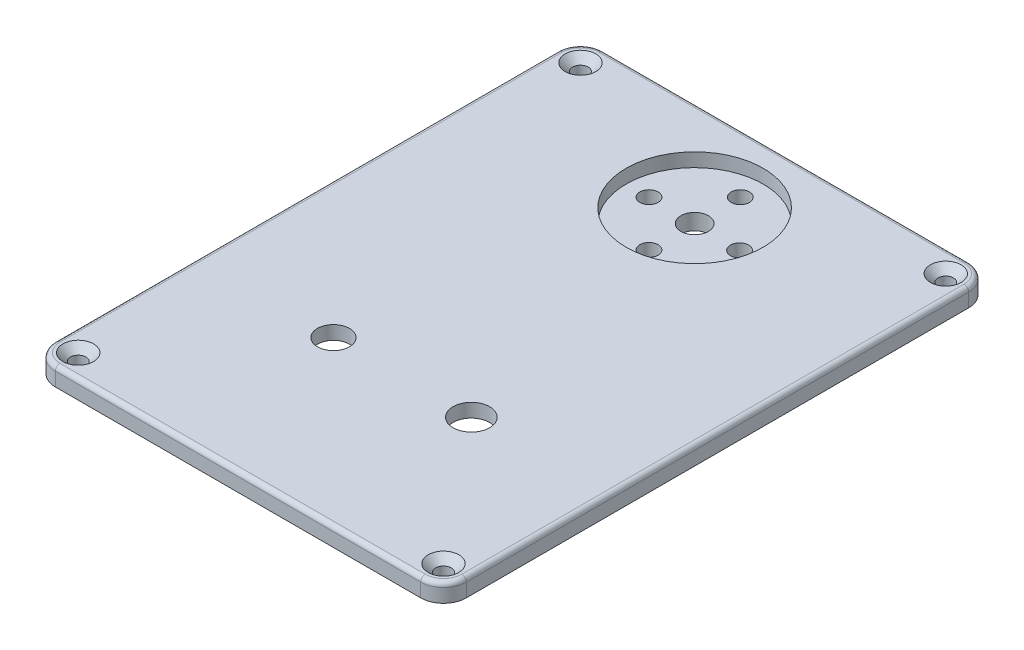
from build123d import *

# Parameters (mm, degrees)
SKETCH_2_W                   = 90
SKETCH_2_H                   = 120
SKETCH_2_R                   = 15
EXTRUDE_1_DEPTH              = 3
SKETCH_3_W                   = 90
SKETCH_3_H                   = 120
EXTRUDE_2_DEPTH              = 1
SKETCH_8_R                   = 3
EXTRUDE_5_DEPTH              = 3.5
SKETCH_10_R                  = 2
CUT_EXTRUDE_2_DEPTH          = 3.1
HOLE_WIZARD_M3_3_D           = 3.4
HOLE_WIZARD_M3_3_CSINK_D     = 6.72
HOLE_WIZARD_M3_3_CSINK_ANGLE = 90
FILLET_2_R                   = 5
FILLET_3_R                   = 5
FILLET_4_R                   = 5
FILLET_5_R                   = 5
FILLET_6_R                   = 5
FILLET_7_R                   = 5
FILLET_8_R                   = 5
FILLET_9_R                   = 5
FILLET_10_R                  = 1
SKETCH_16_R                  = 3.5
SKETCH_16_R_2                = 4
CUT_EXTRUDE_3_DEPTH          = 3


with BuildPart() as part:
    # 草图2 → 凸台-拉伸1 (new body)
    with BuildSketch(Plane(origin=(0, 0, 0), x_dir=(1, 0, 0), z_dir=(0, 1, 0))):
        Rectangle(SKETCH_2_W, SKETCH_2_H)
        with Locations(Location((0, 40, 0), (0, 0, 270))):
            Circle(SKETCH_2_R, mode=Mode.SUBTRACT)
    extrude(amount=EXTRUDE_1_DEPTH)



with BuildPart() as body_2:
    # 草图3 → 凸台-拉伸2 (new body)
    with BuildSketch(Plane.XZ):
        Rectangle(SKETCH_3_W, SKETCH_3_H)
        Polygon((-42, -50), (-42, 50), (-35, 50), (-35, 57), (35, 57), (35, 50), (42, 50), (42, -50), (35, -50), (35, -57), (-35, -57), (-35, -50), align=None, mode=Mode.SUBTRACT)
    extrude(amount=EXTRUDE_2_DEPTH)


with BuildPart() as part_1:
    add(part.part)

    add(body_2.part)  # 凸台-拉伸5 merges body 2
    # 草图8 → 凸台-拉伸5 (add)
    with BuildSketch(Plane.XZ):
        with BuildLine():
            Line((-5.916079783, -57), (5.916079783, -57))
            ThreePointArc((5.916079783, -57), (0, -22), (-5.916079783, -57))
        make_face()
        with Locations(Location((0, -40, 0), (0, 0, 270))):
            Circle(SKETCH_8_R, mode=Mode.SUBTRACT)
    extrude(amount=EXTRUDE_5_DEPTH)

    # 草图10 → 切除-拉伸2 (cut)
    with BuildSketch(Plane(origin=(0, 0, 0), x_dir=(1, 0, 0), z_dir=(0, 1, 0))):
        with Locations(Location((0, 30, 0), (0, 0, 270))):
            Circle(SKETCH_10_R)
        with Locations(Location((10, 39.837399549, 0), (0, 0, 270))):
            Circle(SKETCH_10_R)
        with Locations(Location((0, 50, 0), (0, 0, 270))):
            Circle(SKETCH_10_R)
        with Locations(Location((-10, 40, 0), (0, 0, 270))):
            Circle(SKETCH_10_R)
    extrude(amount=-CUT_EXTRUDE_2_DEPTH, mode=Mode.SUBTRACT)

    # M3 六角凹锥坑螺钉的锥形沉头孔3 (through all)
    with Locations(Plane(origin=(0, 3, 0), x_dir=(1, 0, 0), z_dir=(0, 1, 0))):
        with Locations((-40, -55), (-40, 55), (40, 55), (40, -55)):
            CounterSinkHole(HOLE_WIZARD_M3_3_D / 2, HOLE_WIZARD_M3_3_CSINK_D / 2, counter_sink_angle=HOLE_WIZARD_M3_3_CSINK_ANGLE)

    # 圆角2
    fillet_2_edges = [part_1.edges().sort_by_distance(p)[0] for p in [
        (35, -0.5, -50),
    ]]
    fillet(fillet_2_edges, radius=FILLET_2_R)

    # 圆角3
    fillet_3_edges = [part_1.edges().sort_by_distance(p)[0] for p in [
        (35, -0.5, 50),
    ]]
    fillet(fillet_3_edges, radius=FILLET_3_R)

    # 圆角4
    fillet_4_edges = [part_1.edges().sort_by_distance(p)[0] for p in [
        (-35, -0.5, 50),
    ]]
    fillet(fillet_4_edges, radius=FILLET_4_R)

    # 圆角5
    fillet_5_edges = [part_1.edges().sort_by_distance(p)[0] for p in [
        (-35, -0.5, -50),
    ]]
    fillet(fillet_5_edges, radius=FILLET_5_R)

    # 圆角6
    fillet_6_edges = [part_1.edges().sort_by_distance(p)[0] for p in [
        (-45, 1, -60),
    ]]
    fillet(fillet_6_edges, radius=FILLET_6_R)

    # 圆角7
    fillet_7_edges = [part_1.edges().sort_by_distance(p)[0] for p in [
        (45, 1, -60),
    ]]
    fillet(fillet_7_edges, radius=FILLET_7_R)

    # 圆角8
    fillet_8_edges = [part_1.edges().sort_by_distance(p)[0] for p in [
        (45, 1, 60),
    ]]
    fillet(fillet_8_edges, radius=FILLET_8_R)

    # 圆角9
    fillet_9_edges = [part_1.edges().sort_by_distance(p)[0] for p in [
        (-45, 1, 60),
    ]]
    fillet(fillet_9_edges, radius=FILLET_9_R)

    # 圆角10
    fillet_10_edges = [part_1.edges().sort_by_distance(p)[0] for p in [
        (-45, 3, 0),
        (-43.535533906, 3, -58.535533906),
        (0, 3, -60),
        (43.535533906, 3, -58.535533906),
        (45, 3, 0),
        (43.535533906, 3, 58.535533906),
        (0, 3, 60),
        (-43.535533906, 3, 58.535533906),
    ]]
    fillet(fillet_10_edges, radius=FILLET_10_R)

    # 圆角11: read off the stored shape, not the designer's step
    # 圆角11 outline → 圆角11 (revolve, cut)
    with BuildSketch(Plane.XY.offset(-40)):
        with BuildLine():
            Line((18, -3.5), (18, -1.5))
            ThreePointArc((18, -1.5), (17.414213562, -2.914213562), (16, -3.5))
            Line((16, -3.5), (18, -3.5))
        make_face()
    revolve(axis=Axis((0, 0, -40), (0, 1, 0)), mode=Mode.SUBTRACT)

    # 草图16 → 切除-拉伸3 (cut)
    with BuildSketch(Plane(origin=(0, 3, 0), x_dir=(1, 0, 0), z_dir=(0, 1, 0))):
        with Locations(Location((-14.923003693, -24.181999786, 0), (0, 0, 270))):
            Circle(SKETCH_16_R)
        with Locations(Location((15.276985626, -24.181999786, 0), (0, 0, 270))):
            Circle(SKETCH_16_R_2)
    extrude(amount=-CUT_EXTRUDE_3_DEPTH, mode=Mode.SUBTRACT)


solid = part_1.part
